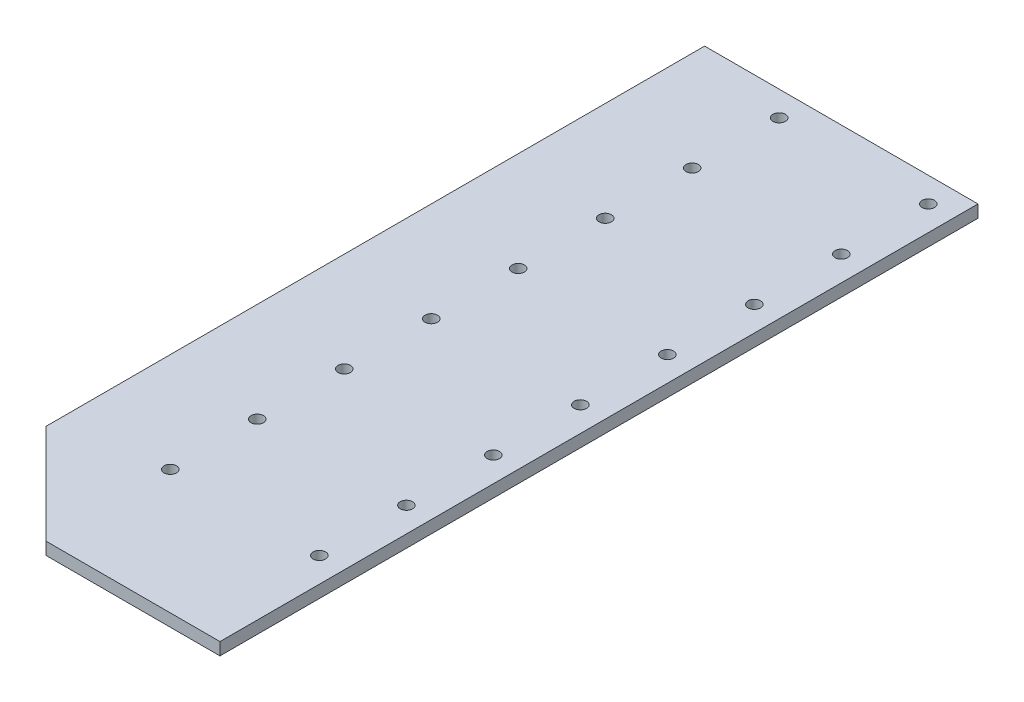
from build123d import *

# Parameters (mm, degrees)
SKETCH1_R           = 2.5
BOSS_EXTRUDE1_DEPTH = 5


with BuildPart() as part:
    # Sketch1 → Boss-Extrude1 (new body)
    with BuildSketch(Plane(origin=(0, 0, 0), x_dir=(1, 0, 0), z_dir=(0, 1, 0))):
        Polygon((0, 0), (0, 265), (110, 265), (110, 0), (110, -40), (40, -40), align=None)
        with Locations((40, 255)):
            Circle(SKETCH1_R, mode=Mode.SUBTRACT)
        with Locations((100, 255)):
            Circle(SKETCH1_R, mode=Mode.SUBTRACT)
        with Locations((40, 220)):
            Circle(SKETCH1_R, mode=Mode.SUBTRACT)
        with Locations((100, 220)):
            Circle(SKETCH1_R, mode=Mode.SUBTRACT)
        with Locations((40, 185)):
            Circle(SKETCH1_R, mode=Mode.SUBTRACT)
        with Locations((100, 185)):
            Circle(SKETCH1_R, mode=Mode.SUBTRACT)
        with Locations((40, 150)):
            Circle(SKETCH1_R, mode=Mode.SUBTRACT)
        with Locations((100, 150)):
            Circle(SKETCH1_R, mode=Mode.SUBTRACT)
        with Locations((40, 115)):
            Circle(SKETCH1_R, mode=Mode.SUBTRACT)
        with Locations((100, 115)):
            Circle(SKETCH1_R, mode=Mode.SUBTRACT)
        with Locations((40, 80)):
            Circle(SKETCH1_R, mode=Mode.SUBTRACT)
        with Locations((100, 80)):
            Circle(SKETCH1_R, mode=Mode.SUBTRACT)
        with Locations((40, 45)):
            Circle(SKETCH1_R, mode=Mode.SUBTRACT)
        with Locations((100, 45)):
            Circle(SKETCH1_R, mode=Mode.SUBTRACT)
        with Locations((40, 10)):
            Circle(SKETCH1_R, mode=Mode.SUBTRACT)
        with Locations((100, 10)):
            Circle(SKETCH1_R, mode=Mode.SUBTRACT)
    extrude(amount=BOSS_EXTRUDE1_DEPTH)


solid = part.part
